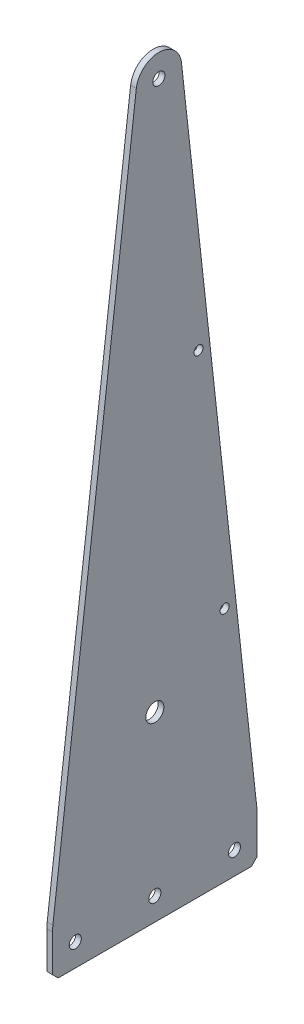
from build123d import *

# Parameters (mm, degrees)
SKETCH2_R           = 5.0419
SKETCH2_R_2         = 3.3782
BOSS_EXTRUDE2_DEPTH = 3.175
SKETCH3_R           = 3.3782
SKETCH3_R_2         = 2.54
CUT_EXTRUDE1_DEPTH  = 443.316377663
CHAMFER1_SIZE       = 3.175
FILLET1_R           = 25.4


with BuildPart() as part:
    # Sketch2 → Boss-Extrude2 (new body)
    with BuildSketch(Plane(origin=(0, 0, 0), x_dir=(0, 0, -1), z_dir=(1, 0, 0))):
        with BuildLine():
            Line((25.4, 0), (25.4, 25.4))
            Line((25.4, 25.4), (72.203914011, 408.503795707))
            ThreePointArc((72.203914011, 408.503795707), (84.884123785, 419.66346835), (97.43353306, 408.356906527))
            Line((97.43353306, 408.356906527), (139.7, 25.4))
            Line((139.7, 25.4), (139.7, 0))
            Line((139.7, 0), (25.4, 0))
        make_face()
        with Locations((82.55, 101.6)):
            Circle(SKETCH2_R, mode=Mode.SUBTRACT)
        with Locations((84.810184462, 406.963683589)):
            Circle(SKETCH2_R_2, mode=Mode.SUBTRACT)
    extrude(amount=BOSS_EXTRUDE2_DEPTH)

    # Sketch3 → Cut-Extrude1 (cut, through all)
    with BuildSketch(Plane(origin=(3.175, 0, 0), x_dir=(0, 0, -1), z_dir=(1, 0, 0))):
        with Locations((38.1, 12.7)):
            Circle(SKETCH3_R)
        with Locations((82.55, 12.7)):
            Circle(SKETCH3_R)
        with Locations((127, 12.7)):
            Circle(SKETCH3_R)
        with Locations((106.923885908, 264.485436327)):
            Circle(SKETCH3_R_2)
        with Locations((121.519346598, 132.242718164)):
            Circle(SKETCH3_R_2)
    extrude(amount=-CUT_EXTRUDE1_DEPTH, mode=Mode.SUBTRACT)

    # Chamfer1
    chamfer1_edges = [part.edges().sort_by_distance(p)[0] for p in [
        (1.5875, 0, -25.4),
        (1.5875, 0, -139.7),
    ]]
    chamfer(chamfer1_edges, length=CHAMFER1_SIZE)

    # Fillet1
    fillet1_edges = [part.edges().sort_by_distance(p)[0] for p in [
        (1.5875, 25.4, -139.7),
        (1.5875, 25.4, -25.4),
    ]]
    fillet(fillet1_edges, radius=FILLET1_R)


solid = part.part
